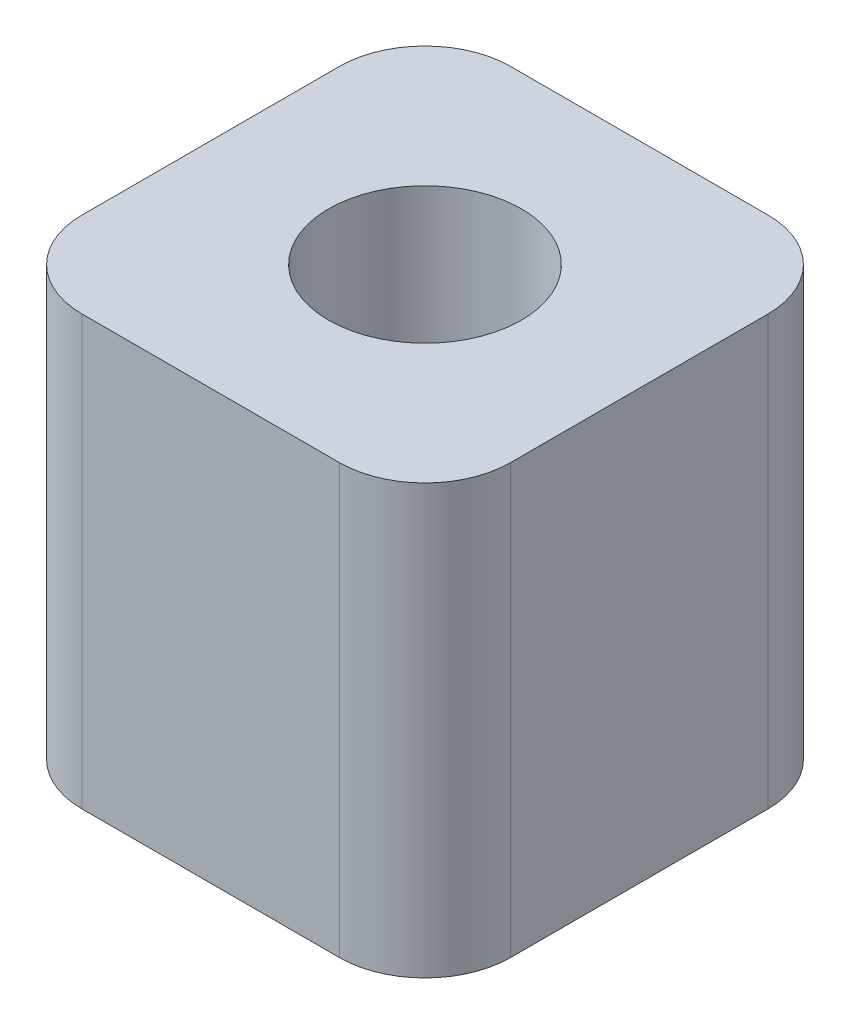
from build123d import *

# Parameters (mm, degrees)
SKETCH1_W           = 10
SKETCH1_H           = 10
SKETCH1_R           = 2.25
BOSS_EXTRUDE1_DEPTH = 10
FILLET1_R           = 2


with BuildPart() as part:
    # Sketch1 → Boss-Extrude1 (new body)
    with BuildSketch(Plane(origin=(0, 0, 0), x_dir=(1, 0, 0), z_dir=(0, 1, 0))):
        Rectangle(SKETCH1_W, SKETCH1_H)
        Circle(SKETCH1_R, mode=Mode.SUBTRACT)
    extrude(amount=BOSS_EXTRUDE1_DEPTH)

    # Fillet1
    fillet1_edges = [part.edges().sort_by_distance(p)[0] for p in [
        (-5, 5, 5),
        (-5, 5, -5),
        (5, 5, -5),
        (5, 5, 5),
    ]]
    fillet(fillet1_edges, radius=FILLET1_R)


solid = part.part
